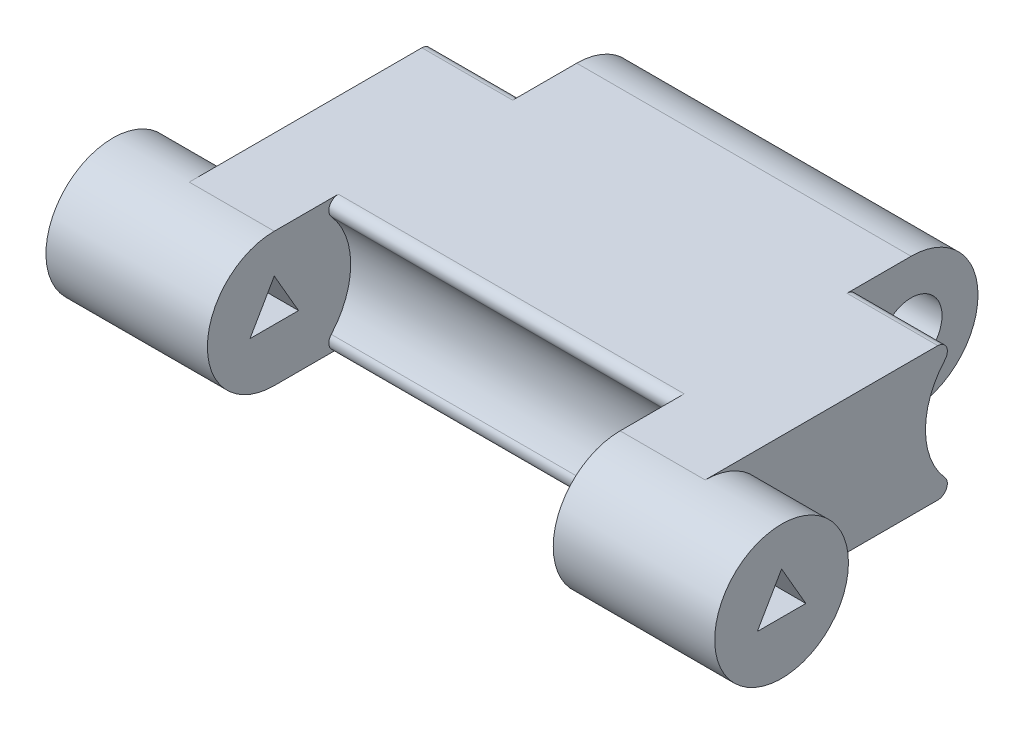
from build123d import *

# Parameters (mm, degrees)
EXTRUDE_1_DEPTH     = 17.5
SKETCH_3_W          = 24
SKETCH_3_H          = 9
SKETCH_3_R          = 3.5
CUT_EXTRUDE_1_DEPTH = 4
SKETCH_6_R          = 4
CUT_EXTRUDE_2_DEPTH = 9.05
SKETCH_7_R          = 4
CUT_EXTRUDE_3_DEPTH = 4.75
SKETCH_8_R          = 1.616666667
CUT_EXTRUDE_4_DEPTH = 38.428601697
FILLET_1_R          = 0.5
EXTRUDE_START       = -1
SKETCH_9_R          = 3.5
SKETCH_9_R_2        = 0.75
EXTRUDE_2_DEPTH     = 1


with BuildPart() as part:
    # Эскиз1 → Бобышка-Вытянуть1 (new, symmetric)
    with BuildSketch(Plane(origin=(0, 0, 0), x_dir=(0, 0, -1), z_dir=(1, 0, 0))):
        with BuildLine():
            Line((-7.765, 7), (7.765, 7))
            ThreePointArc((7.765, 7), (11.265, 3.5), (7.765, 0))
            Line((7.765, 0), (-7.765, 0))
            ThreePointArc((-7.765, 0), (-11.265, 3.5), (-7.765, 7))
        make_face()
    extrude(amount=EXTRUDE_1_DEPTH, both=True)

    # Эскиз3 → Вырез-Вытянуть1 (cut)
    with BuildSketch(Plane(origin=(17.5, 0, 0), x_dir=(0, 0, -1), z_dir=(1, 0, 0))):
        with Locations((0, 3.5)):
            Rectangle(SKETCH_3_W, SKETCH_3_H)
        with Locations((-7.765, 3.5)):
            Circle(SKETCH_3_R, mode=Mode.SUBTRACT)
    cut_extrude_1 = extrude(amount=-CUT_EXTRUDE_1_DEPTH, mode=Mode.SUBTRACT)

    # Зеркальное отражение1: Вырез-Вытянуть1 across plane
    add(cut_extrude_1.mirror(Plane(origin=(0, 0, 0), x_dir=(0, 0, 1), z_dir=(1, 0, 0))), mode=Mode.SUBTRACT)

    # Эскиз6 → Вырез-Вытянуть2 (cut, symmetric)
    with BuildSketch(Plane(origin=(0, 0, 0), x_dir=(0, 0, -1), z_dir=(1, 0, 0))):
        with Locations((-7.765, 3.5)):
            Circle(SKETCH_6_R)
    extrude(amount=CUT_EXTRUDE_2_DEPTH, both=True, mode=Mode.SUBTRACT)

    # Эскиз7 → Вырез-Вытянуть3 (cut)
    with BuildSketch(Plane(origin=(13.5, 0, 0), x_dir=(0, 0, -1), z_dir=(1, 0, 0))):
        with Locations((7.765, 3.5)):
            Circle(SKETCH_7_R)
    cut_extrude_3 = extrude(amount=-CUT_EXTRUDE_3_DEPTH, mode=Mode.SUBTRACT)

    # Зеркальное отражение2: Вырез-Вытянуть3 across plane
    add(cut_extrude_3.mirror(Plane(origin=(0, 0, 0), x_dir=(0, 0, 1), z_dir=(1, 0, 0))), mode=Mode.SUBTRACT)

    # Эскиз8 → Вырез-Вытянуть4 (cut, through all)
    with BuildSketch(Plane(origin=(17.5, 0, 0), x_dir=(0, 0, -1), z_dir=(1, 0, 0))):
        with Locations((7.765, 3.5)):
            Circle(SKETCH_8_R)
        Polygon((-9.035170592, 2.766666667), (-7.765, 4.966666667), (-6.494829408, 2.766666667), align=None)
    extrude(amount=-CUT_EXTRUDE_4_DEPTH, mode=Mode.SUBTRACT)

    # Скругление1
    fillet_1_edges = [part.edges().sort_by_distance(p)[0] for p in [
        (-11.125, 0, -5.828508327),
        (-11.125, 7, -5.828508327),
        (0, 7, 5.828508327),
        (0, 0, 5.828508327),
        (11.125, 7, -5.828508327),
        (11.125, 0, -5.828508327),
    ]]
    fillet(fillet_1_edges, radius=FILLET_1_R)

    # Эскиз9 → Бобышка-Вытянуть2 (add)
    with BuildSketch(Plane.ZY.offset(17.5).offset(EXTRUDE_START)):
        with Locations((7.765, 3.5)):
            Circle(SKETCH_9_R)
        with Locations((7.765, 3.5)):
            Circle(SKETCH_9_R_2, mode=Mode.SUBTRACT)
    extrude(amount=EXTRUDE_2_DEPTH)


solid = part.part
